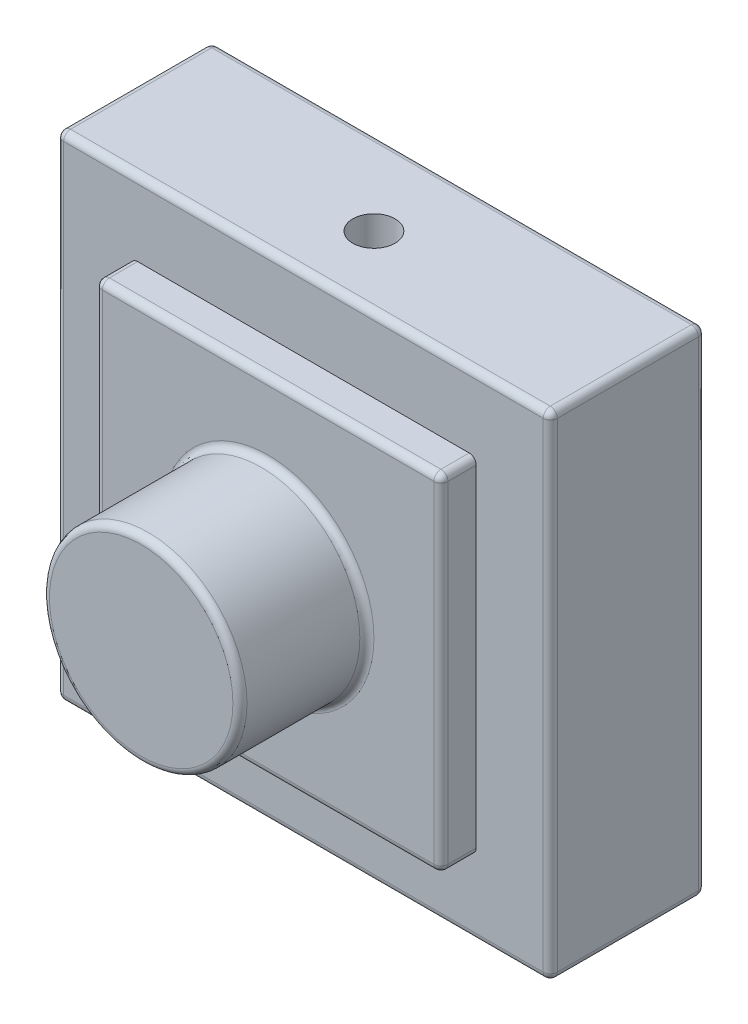
from build123d import *

# Parameters (mm, degrees)
SKETCH1_W           = 35
SKETCH1_H           = 35
BOSS_EXTRUDE1_DEPTH = 11
SKETCH2_R           = 1.5
CUT_EXTRUDE1_DEPTH  = 5
SKETCH3_W           = 24.5
SKETCH3_H           = 24.5
BOSS_EXTRUDE2_DEPTH = 2.5
SKETCH4_R           = 7
BOSS_EXTRUDE3_DEPTH = 9
FILLET1_R           = 0.5
FILLET2_R           = 0.5


with BuildPart() as part:
    # Sketch1 → Boss-Extrude1 (new body)
    with BuildSketch(Plane.XY):
        Rectangle(SKETCH1_W, SKETCH1_H)
    extrude(amount=BOSS_EXTRUDE1_DEPTH)

    # Sketch2 → Cut-Extrude1 (cut)
    with BuildSketch(Plane(origin=(0, 17.5, 0), x_dir=(1, 0, 0), z_dir=(0, 1, 0))):
        with Locations((0, -6)):
            Circle(SKETCH2_R)
    cut_extrude1 = extrude(amount=-CUT_EXTRUDE1_DEPTH, mode=Mode.SUBTRACT)

    # Mirror1: Cut-Extrude1 across plane
    add(cut_extrude1.mirror(Plane.ZX), mode=Mode.SUBTRACT)

    # Sketch3 → Boss-Extrude2 (add)
    with BuildSketch(Plane.XY.offset(11)):
        Rectangle(SKETCH3_W, SKETCH3_H)
    extrude(amount=BOSS_EXTRUDE2_DEPTH)

    # Sketch4 → Boss-Extrude3 (add)
    with BuildSketch(Plane.XY.offset(13.5)):
        Circle(SKETCH4_R)
    extrude(amount=BOSS_EXTRUDE3_DEPTH)

    # Fillet1
    fillet1_edges = [part.edges().sort_by_distance(p)[0] for p in [
        (17.5, 0, 11),
        (17.5, 0, 0),
        (-17.5, 0, 0),
        (0, 17.5, 0),
        (0, -17.5, 0),
        (0, -17.5, 11),
        (-17.5, 0, 11),
        (0, 12.25, 13.5),
        (-12.25, 0, 13.5),
        (0, -12.25, 13.5),
        (12.25, 0, 13.5),
        (-12.25, -12.25, 12.25),
        (-12.25, 12.25, 12.25),
        (12.25, -12.25, 12.25),
        (-7, 0, 13.5),
        (12.25, 12.25, 12.25),
        (-17.5, -17.5, 5.5),
        (-17.5, 17.5, 5.5),
        (17.5, -17.5, 5.5),
        (17.5, 17.5, 5.5),
        (0, 17.5, 11),
    ]]
    fillet(fillet1_edges, radius=FILLET1_R)

    # Fillet2
    fillet2_edges = [part.edges().sort_by_distance(p)[0] for p in [
        (-7, 0, 22.5),
    ]]
    fillet(fillet2_edges, radius=FILLET2_R)


solid = part.part
